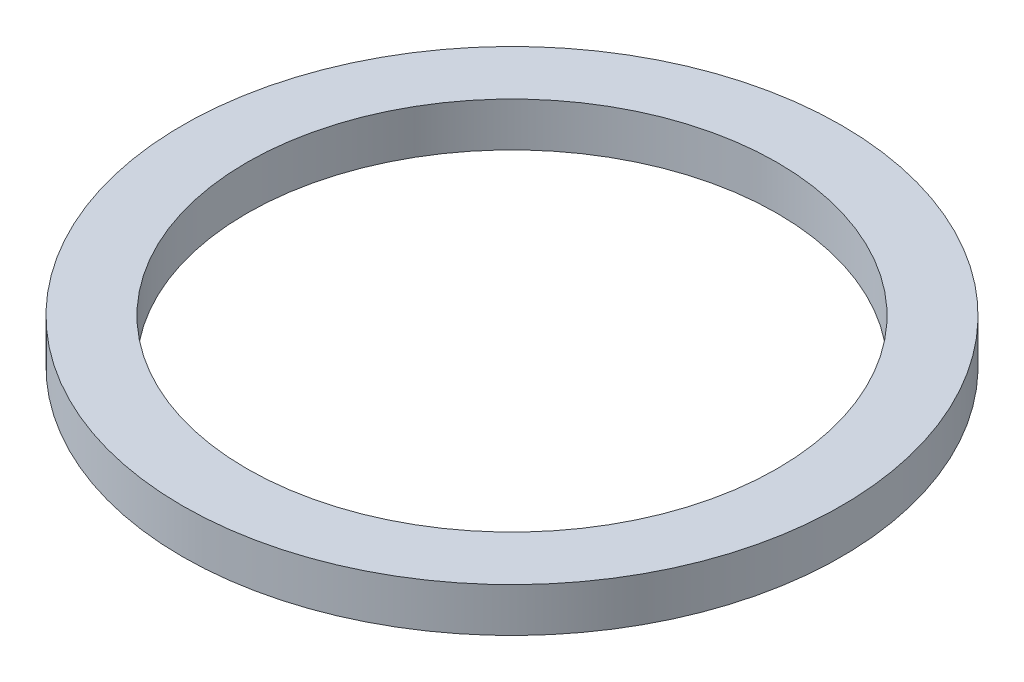
from build123d import *

# Parameters (mm, degrees)
SKETCH2_R           = 42.25
SKETCH2_R_2         = 34
BOSS_EXTRUDE1_DEPTH = 5.65


with BuildPart() as part:
    # Sketch2 → Boss-Extrude1 (new body)
    with BuildSketch(Plane(origin=(0, 0, 0), x_dir=(1, 0, 0), z_dir=(0, 1, 0))):
        Circle(SKETCH2_R)
        Circle(SKETCH2_R_2, mode=Mode.SUBTRACT)
    extrude(amount=BOSS_EXTRUDE1_DEPTH)


solid = part.part
